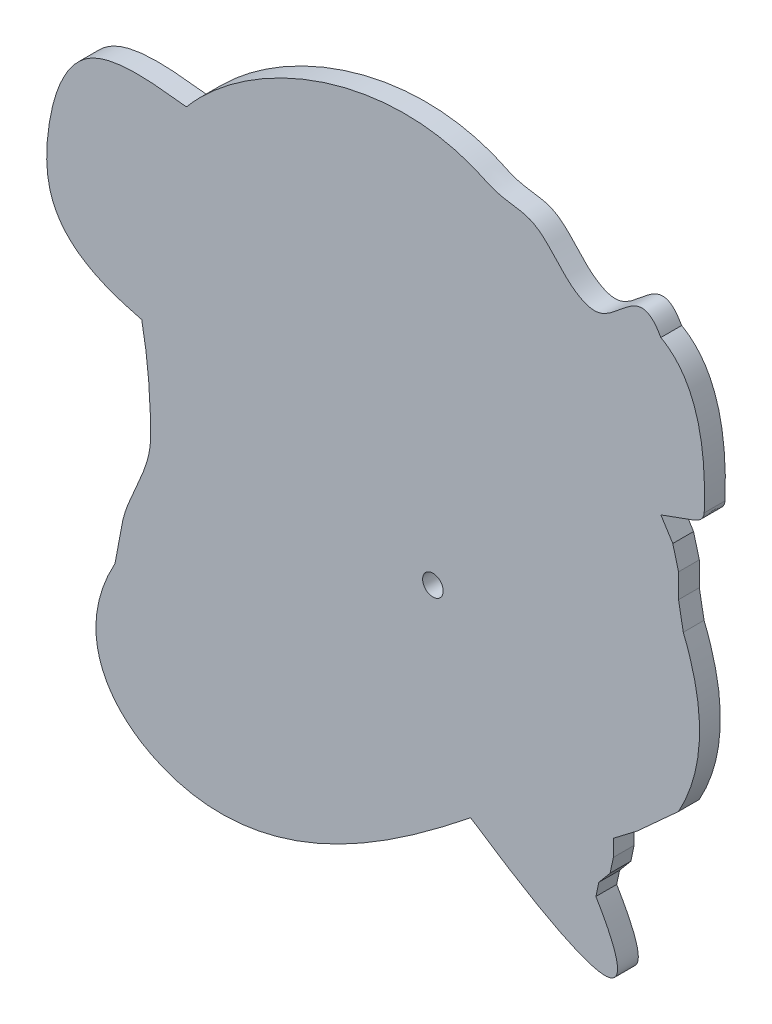
from build123d import *

# Parameters (mm, degrees)
SKETCH1_R           = 1.5748
BOSS_EXTRUDE2_DEPTH = 3.175


with BuildPart() as part:
    # Sketch1 → Boss-Extrude2 (new body)
    with BuildSketch(Plane.XY):
        with BuildLine():
            Line((158.848647409, 158.065989154), (159.287258197, 160.158039444))
            Line((159.287258197, 160.158039444), (161.024283069, 162.24246929))
            Line((161.024283069, 162.24246929), (161.51276424, 164.572387305))
            Line((161.51276424, 164.572387305), (161.51276424, 167.102297744))
            Line((161.51276424, 167.102297744), (165.183542032, 169.901250177))
            Line((165.183542032, 169.901250177), (171.472031107, 175.621746691))
            add(Edge.make_bspline(
                [(172.196352762, 199.687728108), (177.512545782, 186.611864968), (171.472031107, 175.621746691)],
                knots=[0, 0, 0, 1, 1, 1], degree=2))
            Line((172.196352762, 199.687728108), (171.472031107, 203.640454502))
            Line((171.472031107, 203.640454502), (171.472031107, 207.328620776))
            Line((171.472031107, 207.328620776), (170.591456875, 210.633600942))
            Line((170.591456875, 210.633600942), (168.77132287, 213.50749674))
            Line((168.77132287, 213.50749674), (173.762076079, 215.323183876))
            add(Edge.make_bspline(
                [(173.762076079, 215.323183876), (175.299052296, 215.889997376), (175.39725561, 217.089480705)],
                knots=[0, 0, 0, 1, 1, 1], degree=2))
            add(Edge.make_bspline(
                [(168.77132287, 236.972843892), (176.024535693, 232.91356426), (175.39725561, 217.089480705)],
                knots=[0, 0, 0, 1, 1, 1], degree=2))
            add(Edge.make_bspline(
                [(168.77132287, 236.972843892), (165.348333102, 243.181818321), (161.713024872, 233.590500252), (153.591853048, 237.311005477), (150.562230052, 243.292497992), (144.26627276, 243.172724883), (127.539588232, 251.709519765), (106.089408502, 242.945117572), (96.305367629, 231.252858967)],
                knots=[0, 0, 0, 0, 0.145953372, 0.187032347, 0.301264876, 0.367851833, 0.402074687, 1, 1, 1, 1], degree=3))
            add(Edge.make_bspline(
                [(89.47301913, 199.687728108), (76.414076731, 202.778398102), (72.921006176, 212.695352185), (79.130886224, 233.86725835), (92.35711514, 231.654519072), (96.305367629, 231.252858967)],
                knots=[0, 0, 0, 0, 0.435393148, 0.719886863, 1, 1, 1, 1], degree=3))
            add(Edge.make_bspline(
                [(89.47301913, 199.687728108), (90.449698127, 194.83749072), (90.825955315, 189.837761557), (90.838257386, 180.280743918), (87.678298822, 176.191377166), (86.590775441, 171.767770411)],
                knots=[0, 0, 0, 0, 0.517811069, 0.520823107, 1, 1, 1, 1], degree=3))
            Line((86.590775441, 171.767770411), (85.388246292, 165.381063893))
            add(Edge.make_bspline(
                [(85.388246292, 165.381063893), (78.04872596, 152.035766171), (100.062572602, 129.842406555), (127.319187547, 149.003850163), (139.710762388, 158.909562117)],
                knots=[0, 0, 0, 0, 0.355983936, 1, 1, 1, 1], degree=3))
            add(Edge.make_bspline(
                [(139.710762388, 158.909562117), (170.754327721, 138.111319354), (158.848647409, 158.065989154)],
                knots=[0, 0, 0, 1, 1, 1], degree=2))
        make_face()
        with Locations((133.949942357, 186.810985104)):
            Circle(SKETCH1_R, mode=Mode.SUBTRACT)
    extrude(amount=BOSS_EXTRUDE2_DEPTH)


solid = part.part
